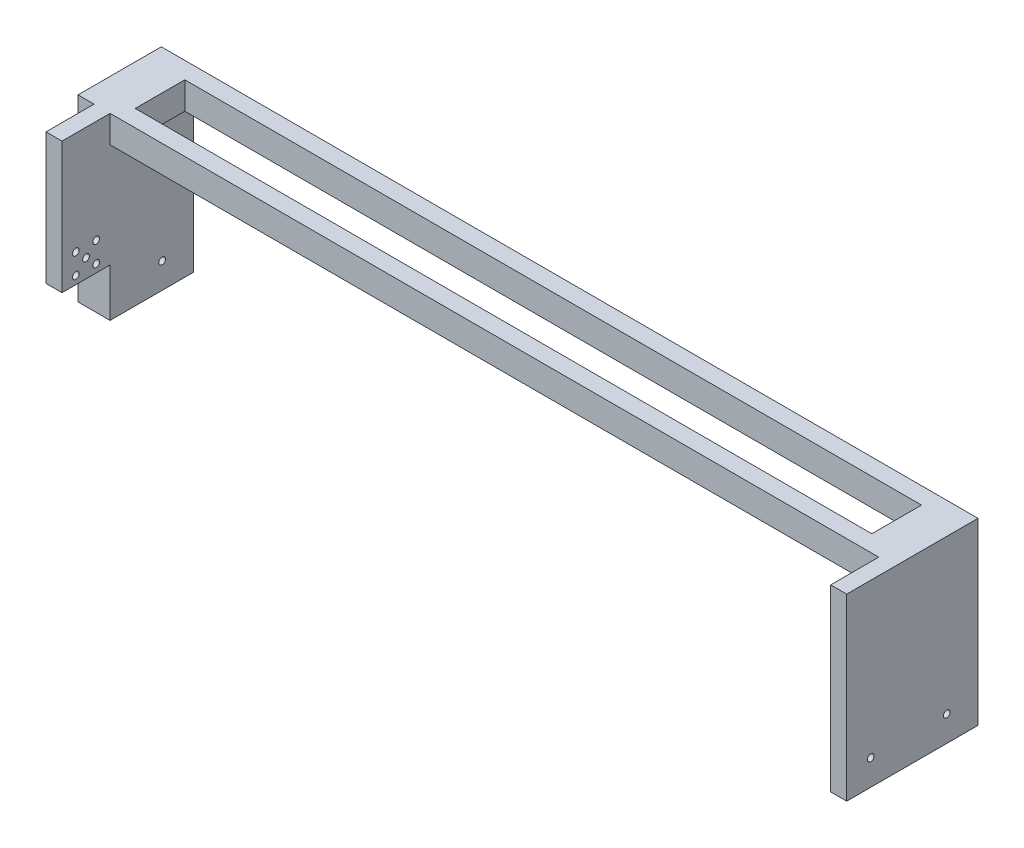
from build123d import *

# Parameters (mm, degrees)
BOSS_EXTRUDE1_DEPTH      = 82
BOSS_EXTRUDE1_DEPTH_BACK = 0.001
SKETCH2_W                = 480
SKETCH2_H                = 65
CUT_EXTRUDE2_DEPTH       = 82
SKETCH3_W                = 20
SKETCH3_H                = 52
SKETCH3_W_2              = 10
SKETCH3_H_2              = 82
BOSS_EXTRUDE3_DEPTH      = 30
SKETCH4_R                = 2.1
CUT_EXTRUDE3_DEPTH       = 618
SKETCH5_W                = 460
SKETCH5_H                = 31
CUT_EXTRUDE4_DEPTH       = 42
SKETCH6_R                = 2.1
CUT_EXTRUDE5_DEPTH       = 10


with BuildPart() as part:
    # Sketch1 → Boss-Extrude1 (new, two sides: drawn at the far end of the back side and taken through both)
    with BuildSketch(Plane(origin=(0, 0, 0), x_dir=(1, 0, 0), z_dir=(0, 1, 0)).offset(-BOSS_EXTRUDE1_DEPTH_BACK)):
        Polygon((10, -82), (10, -52), (0, -52), (0, 0), (510, 0), (510, -82), (500, -82), (500, -52), (20, -52), (20, -82), align=None)
    extrude(amount=BOSS_EXTRUDE1_DEPTH + BOSS_EXTRUDE1_DEPTH_BACK)

    # Sketch2 → Cut-Extrude2 (cut)
    with BuildSketch(Plane.XY):
        with Locations((260, 32.499)):
            Rectangle(SKETCH2_W, SKETCH2_H)
    extrude(amount=CUT_EXTRUDE2_DEPTH, mode=Mode.SUBTRACT)

    # Sketch3 → Boss-Extrude3 (add)
    with BuildSketch(Plane(origin=(0, 0, 0), x_dir=(1, 0, 0), z_dir=(0, 1, 0))):
        with Locations((10, -26)):
            Rectangle(SKETCH3_W, SKETCH3_H)
        with Locations((505, -41)):
            Rectangle(SKETCH3_W_2, SKETCH3_H_2)
    extrude(amount=-BOSS_EXTRUDE3_DEPTH)

    # Sketch4 → Cut-Extrude3 (cut)
    with BuildSketch(Plane(origin=(510, 0, 0), x_dir=(0, 0, -1), z_dir=(1, 0, 0))):
        with Locations((-67, -14.051)):
            Circle(SKETCH4_R)
        with Locations((-19.50000001, -14.05)):
            Circle(SKETCH4_R)
    extrude(amount=-CUT_EXTRUDE3_DEPTH, mode=Mode.SUBTRACT)

    # Sketch5 → Cut-Extrude4 (cut)
    with BuildSketch(Plane(origin=(0, 82, 0), x_dir=(1, 0, 0), z_dir=(0, 1, 0))):
        with Locations((255.200000001, -26)):
            Rectangle(SKETCH5_W, SKETCH5_H)
    extrude(amount=-CUT_EXTRUDE4_DEPTH, mode=Mode.SUBTRACT)

    # Sketch6 → Cut-Extrude5 (cut)
    with BuildSketch(Plane(origin=(20, 0, 0), x_dir=(0, 0, -1), z_dir=(1, 0, 0))):
        with Locations((-67, 11.349)):
            Circle(SKETCH6_R)
        with Locations((-60.65, 17.699)):
            Circle(SKETCH6_R)
        with Locations((-73.35, 17.699)):
            Circle(SKETCH6_R)
        with Locations((-73.35, 4.999)):
            Circle(SKETCH6_R)
        with Locations((-60.65, 4.999)):
            Circle(SKETCH6_R)
    extrude(amount=-CUT_EXTRUDE5_DEPTH, mode=Mode.SUBTRACT)


solid = part.part
